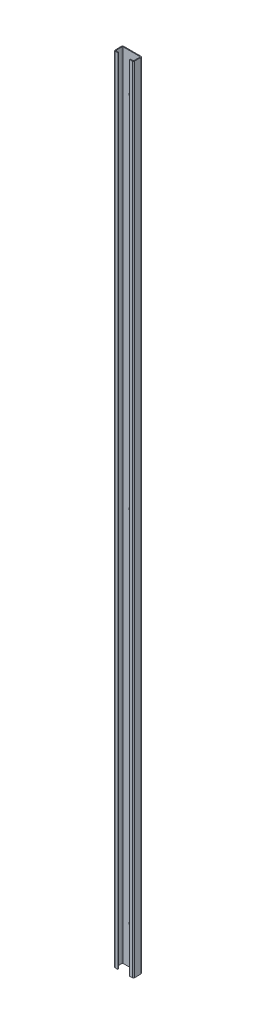
from build123d import *

# Parameters (mm, degrees)
BASEFLANGE_W                   = 50
BASEFLANGE_H                   = 2047
BASE_FLANGE1_DEPTH             = 2
EDGE_FLANGE1_STRIP_W           = 10
EDGE_FLANGE1_STRIP_H           = 2
EDGE_FLANGE1_STRIP_CUT_DEPTH   = 2047
EDGE_FLANGE1_STRIP_2_W         = 10
EDGE_FLANGE1_STRIP_2_H         = 2
EDGE_FLANGE1_STRIP_CUT_2_DEPTH = 2047
EDGE_FLANGE1_DEPTH             = 2047
EDGE_FLANGE1_BEND_DEPTH        = 2047
EDGE_FLANGE2_STRIP_W           = 10
EDGE_FLANGE2_STRIP_H           = 2
EDGE_FLANGE2_STRIP_CUT_DEPTH   = 2047
EDGE_FLANGE2_STRIP_2_W         = 10
EDGE_FLANGE2_STRIP_2_H         = 2
EDGE_FLANGE2_STRIP_CUT_2_DEPTH = 2047
EDGE_FLANGE2_DEPTH             = 2047
EDGE_FLANGE2_BEND_DEPTH        = 2047
HINGEHOLES_R                   = 4.6
CUT_EXTRUDE1_DEPTH             = 1025.041625131


# Sheet-metal steps are written as plain solids
with BuildPart() as part:
    # BaseFlange → Base-Flange1 (new body)
    with BuildSketch(Plane.XY):
        Rectangle(BASEFLANGE_W, BASEFLANGE_H)
    extrude(amount=BASE_FLANGE1_DEPTH)

    # Edge-Flange1 strip (across the edge) → Edge-Flange1 strip cut (cut)
    with BuildSketch(Plane(origin=(25, -1023.5, 2), x_dir=(-1, 0, 0), z_dir=(0, 1, 0))):
        with Locations((-2, -1)):
            Rectangle(EDGE_FLANGE1_STRIP_W, EDGE_FLANGE1_STRIP_H)
    extrude(amount=EDGE_FLANGE1_STRIP_CUT_DEPTH, mode=Mode.SUBTRACT)

    # Edge-Flange1 strip 2 (across the edge) → Edge-Flange1 strip cut 2 (cut)
    with BuildSketch(Plane(origin=(-25, 1023.5, 2), x_dir=(1, 0, 0), z_dir=(0, -1, 0))):
        with Locations((-2, -1)):
            Rectangle(EDGE_FLANGE1_STRIP_2_W, EDGE_FLANGE1_STRIP_2_H)
    extrude(amount=EDGE_FLANGE1_STRIP_CUT_2_DEPTH, mode=Mode.SUBTRACT)

    # Edge-Flange1 section (across the edge) → Edge-Flange1 (add)
    with BuildSketch(Plane(origin=(25, -1023.5, 2), x_dir=(-1, 0, 0), z_dir=(0, 1, 0))):
        with BuildLine():
            Line((0, 1), (0, 20))
            Line((0, 20), (2, 20))
            Line((2, 20), (2, 1))
            ThreePointArc((2, 1), (2.292893219, 0.292893219), (3, 0))
            Line((3, 0), (3, -2))
            ThreePointArc((3, -2), (0.878679656, -1.121320344), (0, 1))
        make_face()
    extrude(amount=EDGE_FLANGE1_DEPTH)

    # Edge-Flange1 section 2 (across the edge) → Edge-Flange1 bend (add)
    with BuildSketch(Plane(origin=(-25, 1023.5, 2), x_dir=(1, 0, 0), z_dir=(0, -1, 0))):
        with BuildLine():
            Line((0, 1), (0, 20))
            Line((0, 20), (2, 20))
            Line((2, 20), (2, 1))
            ThreePointArc((2, 1), (2.292893219, 0.292893219), (3, 0))
            Line((3, 0), (3, -2))
            ThreePointArc((3, -2), (0.878679656, -1.121320344), (0, 1))
        make_face()
    extrude(amount=EDGE_FLANGE1_BEND_DEPTH)

    # Edge-Flange2 strip (across the edge) → Edge-Flange2 strip cut (cut)
    with BuildSketch(Plane(origin=(-23, 1023.5, 22), x_dir=(0, 0, -1), z_dir=(0, -1, 0))):
        with Locations((-2, -1)):
            Rectangle(EDGE_FLANGE2_STRIP_W, EDGE_FLANGE2_STRIP_H)
    extrude(amount=EDGE_FLANGE2_STRIP_CUT_DEPTH, mode=Mode.SUBTRACT)

    # Edge-Flange2 strip 2 (across the edge) → Edge-Flange2 strip cut 2 (cut)
    with BuildSketch(Plane(origin=(23, -1023.5, 22), x_dir=(0, 0, -1), z_dir=(0, 1, 0))):
        with Locations((-2, -1)):
            Rectangle(EDGE_FLANGE2_STRIP_2_W, EDGE_FLANGE2_STRIP_2_H)
    extrude(amount=EDGE_FLANGE2_STRIP_CUT_2_DEPTH, mode=Mode.SUBTRACT)

    # Edge-Flange2 section (across the edge) → Edge-Flange2 (add)
    with BuildSketch(Plane(origin=(-23, 1023.5, 22), x_dir=(0, 0, -1), z_dir=(0, -1, 0))):
        with BuildLine():
            Line((0, 1), (0, 8))
            Line((0, 8), (2, 8))
            Line((2, 8), (2, 1))
            ThreePointArc((2, 1), (2.292893219, 0.292893219), (3, 0))
            Line((3, 0), (3, -2))
            ThreePointArc((3, -2), (0.878679656, -1.121320344), (0, 1))
        make_face()
    extrude(amount=EDGE_FLANGE2_DEPTH)

    # Edge-Flange2 section 2 (across the edge) → Edge-Flange2 bend (add)
    with BuildSketch(Plane(origin=(23, -1023.5, 22), x_dir=(0, 0, -1), z_dir=(0, 1, 0))):
        with BuildLine():
            Line((0, 1), (0, 8))
            Line((0, 8), (2, 8))
            Line((2, 8), (2, 1))
            ThreePointArc((2, 1), (2.292893219, 0.292893219), (3, 0))
            Line((3, 0), (3, -2))
            ThreePointArc((3, -2), (0.878679656, -1.121320344), (0, 1))
        make_face()
    extrude(amount=EDGE_FLANGE2_BEND_DEPTH)

    # HingeHoles → Cut-Extrude1 (cut, through all)
    with BuildSketch(Plane.XY):
        with Locations(Location((-2, 925.5, 0), (0, 0, 180))):
            Circle(HINGEHOLES_R)
        with Locations(Location((-2, 0, 0), (0, 0, 180))):
            Circle(HINGEHOLES_R)
        with Locations(Location((-2, -925.5, 0), (0, 0, 180))):
            Circle(HINGEHOLES_R)
    extrude(amount=CUT_EXTRUDE1_DEPTH, mode=Mode.SUBTRACT)


solid = part.part
